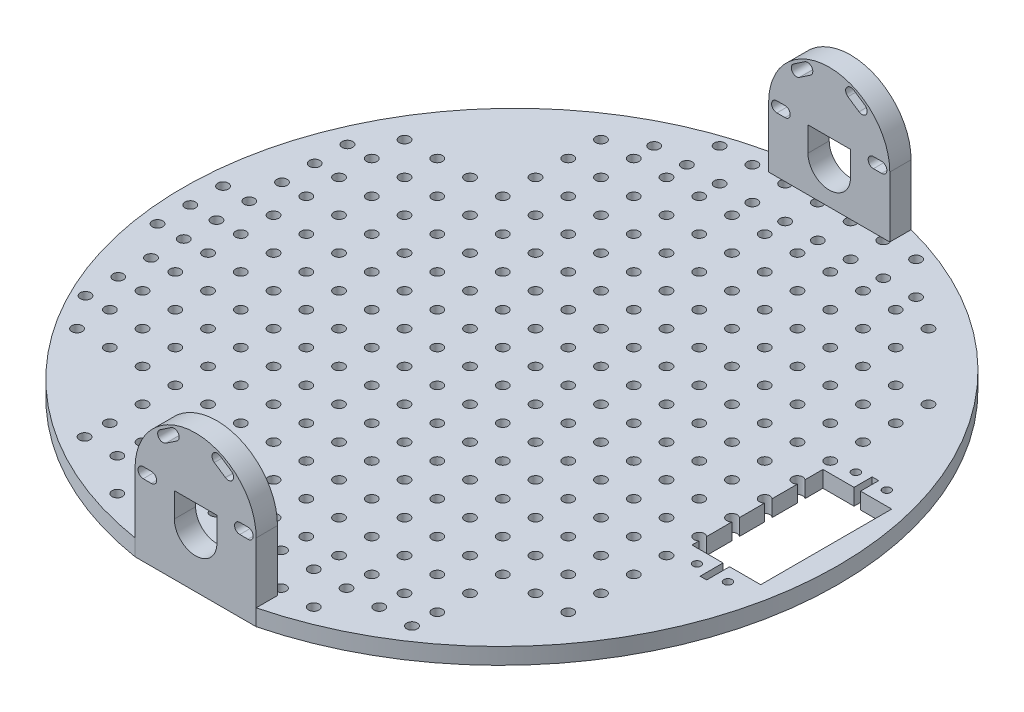
from build123d import *

# Parameters (mm, degrees)
IZIM1_R                          = 18.5
Y_KSEKLIK_EKSTR_ZYON1_DEPTH      = 6.5
KES_EKSTR_ZYON1_DEPTH            = 6.5
Y_KSEKLIK_EKSTR_ZYON2_DEPTH      = 6.5
Y_KSEKLIK_EKSTR_ZYON3_DEPTH      = 30
Y_KSEKLIK_EKSTR_ZYON3_DEPTH_BACK = 6.5
IZIM4_W                          = 37
IZIM4_H                          = 4
IZIM5_W                          = 36.995441418
IZIM5_H                          = 200
Y_KSEKLIK_EKSTR_ZYON4_DEPTH      = 4
Y_KSEKLIK_EKSTR_ZYON6_DEPTH      = 6.5
Y_KSEKLIK_EKSTR_ZYON7_DEPTH      = 4
Y_KSEKLIK_EKSTR_ZYON8_DEPTH      = 6
Y_KSEKLIK_EKSTR_ZYON11_DEPTH     = 10
IZIM17_R                         = 1.6
KES_EKSTR_ZYON2_DEPTH            = 95
IZIM18_R                         = 1.243463058
IZIM18_R_2                       = 1.205968855
IZIM18_R_3                       = 1.223996279
IZIM18_R_4                       = 1.236716662
KES_EKSTR_ZYON3_DEPTH            = 95
IZIM20_R                         = 1.6
KES_EKSTR_ZYON4_DEPTH            = 10
KES_EKSTR_ZYON5_START            = -5
KES_EKSTR_ZYON5_DEPTH            = 5


with BuildPart() as part:
    # Çizim1 → Yükseklik-Ekstrüzyon1 (new body)
    with BuildSketch(Plane.XY):
        with Locations(Location((0, 0, 0), (0, 0, 180))):
            Circle(IZIM1_R)
    extrude(amount=Y_KSEKLIK_EKSTR_ZYON1_DEPTH)

    # Çizim2 → Kes-Ekstrüzyon1 (cut)
    with BuildSketch(Plane.XY.offset(6.5)):
        with BuildLine():
            Line((6.5, 0), (6.5, -7.5))
            ThreePointArc((6.5, -7.5), (0, -14), (-6.5, -7.5))
            Line((-6.5, -7.5), (-6.5, 0))
            Line((-6.5, 0), (6.5, 0))
        make_face()
        with BuildLine():
            Line((-16, 1.6), (-13.5, 1.6))
            ThreePointArc((-13.5, 1.6), (-11.9, 0), (-13.5, -1.6))
            Line((-13.5, -1.6), (-16, -1.6))
            ThreePointArc((-16, -1.6), (-17.6, 0), (-16, 1.6))
        make_face()
        with BuildLine():
            Line((16, -1.6), (13.5, -1.6))
            ThreePointArc((13.5, -1.6), (11.9, 0), (13.5, 1.6))
            Line((13.5, 1.6), (16, 1.6))
            ThreePointArc((16, 1.6), (17.6, 0), (16, -1.6))
        make_face()
        with BuildLine():
            Line((7.510154292, 16.186602557), (10.890511962, 13.897826987))
            ThreePointArc((10.890511962, 13.897826987), (11.31834042, 11.675899263), (9.096412696, 11.248070806))
            Line((9.096412696, 11.248070806), (5.716055026, 13.536846375))
            ThreePointArc((5.716055026, 13.536846375), (5.288226568, 15.758774099), (7.510154292, 16.186602557))
        make_face()
        with BuildLine():
            Line((-7.510154292, 16.186602557), (-10.890511962, 13.897826987))
            ThreePointArc((-10.890511962, 13.897826987), (-11.31834042, 11.675899263), (-9.096412696, 11.248070806))
            Line((-9.096412696, 11.248070806), (-5.716055026, 13.536846375))
            ThreePointArc((-5.716055026, 13.536846375), (-5.288226568, 15.758774099), (-7.510154292, 16.186602557))
        make_face()
    extrude(amount=-KES_EKSTR_ZYON1_DEPTH, mode=Mode.SUBTRACT)

    # Çizim3 → Yükseklik-Ekstrüzyon2 (add)
    with BuildSketch(Plane(origin=(0, 0, 0), x_dir=(-1, 0, 0), z_dir=(0, 0, -1))):
        with BuildLine():
            ThreePointArc((0, -18.5), (-13.081475452, -13.081475452), (-18.5, 0))
            Line((-18.5, 0), (-18.5, -18.5))
            Line((-18.5, -18.5), (0, -18.5))
        make_face()
        with BuildLine():
            Line((18.5, -18.5), (18.5, 0))
            ThreePointArc((18.5, 0), (13.081475452, -13.081475452), (0, -18.5))
            Line((0, -18.5), (18.5, -18.5))
        make_face()
    extrude(amount=-Y_KSEKLIK_EKSTR_ZYON2_DEPTH)

    # Çizim4 → Yükseklik-Ekstrüzyon3 (add, two sides: drawn at the far end of the back side and taken through both)
    with BuildSketch(Plane.XY.offset(6.5).offset(-Y_KSEKLIK_EKSTR_ZYON3_DEPTH_BACK)):
        with Locations((0, -20.5)):
            Rectangle(IZIM4_W, IZIM4_H)
    extrude(amount=Y_KSEKLIK_EKSTR_ZYON3_DEPTH + Y_KSEKLIK_EKSTR_ZYON3_DEPTH_BACK)

    # Çizim5 → Yükseklik-Ekstrüzyon4 (add)
    with BuildSketch(Plane.XZ.offset(22.5)):
        with Locations((-0.002279291, 100)):
            Rectangle(IZIM5_W, IZIM5_H)
    extrude(amount=-Y_KSEKLIK_EKSTR_ZYON4_DEPTH)

    # Çizim10 → Yükseklik-Ekstrüzyon6 (add)
    with BuildSketch(Plane.XY.offset(200)):
        with BuildLine():
            Line((-18.5, 0), (-18.5, -18.5))
            Line((-18.5, -18.5), (18.5, -18.5))
            Line((18.5, -18.5), (18.5, 0))
            ThreePointArc((18.5, 0), (0, 18.5), (-18.5, 0))
        make_face()
        with BuildLine():
            Line((5.716055026, 13.536846375), (9.096412696, 11.248070806))
            ThreePointArc((9.096412696, 11.248070806), (11.31834042, 11.675899263), (10.890511962, 13.897826987))
            Line((10.890511962, 13.897826987), (7.510154292, 16.186602557))
            ThreePointArc((7.510154292, 16.186602557), (5.288226568, 15.758774099), (5.716055026, 13.536846375))
        make_face(mode=Mode.SUBTRACT)
        with BuildLine():
            Line((-7.510154292, 16.186602557), (-10.890511962, 13.897826987))
            ThreePointArc((-10.890511962, 13.897826987), (-11.31834042, 11.675899263), (-9.096412696, 11.248070806))
            Line((-9.096412696, 11.248070806), (-5.716055026, 13.536846375))
            ThreePointArc((-5.716055026, 13.536846375), (-5.288226568, 15.758774099), (-7.510154292, 16.186602557))
        make_face(mode=Mode.SUBTRACT)
        with BuildLine():
            Line((-13.5, 1.6), (-16, 1.6))
            ThreePointArc((-16, 1.6), (-17.6, 0), (-16, -1.6))
            Line((-16, -1.6), (-13.5, -1.6))
            ThreePointArc((-13.5, -1.6), (-11.9, 0), (-13.5, 1.6))
        make_face(mode=Mode.SUBTRACT)
        with BuildLine():
            Line((6.5, -7.5), (6.5, 0))
            Line((6.5, 0), (-6.5, 0))
            Line((-6.5, 0), (-6.5, -7.5))
            ThreePointArc((-6.5, -7.5), (0, -14), (6.5, -7.5))
        make_face(mode=Mode.SUBTRACT)
        with BuildLine():
            Line((13.5, -1.6), (16, -1.6))
            ThreePointArc((16, -1.6), (17.6, 0), (16, 1.6))
            Line((16, 1.6), (13.5, 1.6))
            ThreePointArc((13.5, 1.6), (11.9, 0), (13.5, -1.6))
        make_face(mode=Mode.SUBTRACT)
    extrude(amount=-Y_KSEKLIK_EKSTR_ZYON6_DEPTH)

    # Çizim12 → Yükseklik-Ekstrüzyon7 (add)
    with BuildSketch(Plane(origin=(0, -18.5, 0), x_dir=(1, 0, 0), z_dir=(0, 1, 0))):
        with BuildLine():
            Line((-18.5, 0), (-18.5, -200))
            ThreePointArc((-18.5, -200), (-103.80746971, -100), (-18.5, 0))
        make_face()
    extrude(amount=-Y_KSEKLIK_EKSTR_ZYON7_DEPTH)

    # Çizim14 → Yükseklik-Ekstrüzyon8 (add)
    with BuildSketch(Plane.XZ.offset(22.5)):
        with BuildLine():
            Line((18.5, 36.5), (18.495441418, 36.5))
            Line((18.495441418, 36.5), (18.495441418, 200))
            Line((18.495441418, 200), (-18.5, 200))
            ThreePointArc((-18.5, 200), (-103.80746971, 100), (-18.5, 0))
            Line((-18.5, 0), (18.5, 0))
            Line((18.5, 0), (18.5, 36.5))
        make_face()
    extrude(amount=Y_KSEKLIK_EKSTR_ZYON8_DEPTH)

    # Çizim16 → Yükseklik-Ekstrüzyon11 (add)
    with BuildSketch(Plane(origin=(0, -18.5, 0), x_dir=(1, 0, 0), z_dir=(0, 1, 0))):
        with BuildLine():
            ThreePointArc((18.5, 0), (96.19253029, -100), (18.5, -200))
            Line((18.5, -200), (-18.5, -200))
            Line((-18.5, -200), (-18.5, -193.5))
            Line((-18.5, -193.5), (18.495441418, -193.5))
            Line((18.495441418, -193.5), (18.495441418, -36.5))
            Line((18.495441418, -36.5), (18.5, -36.5))
            Line((18.5, -36.5), (18.5, -6.5))
            Line((18.5, -6.5), (-18.5, -6.5))
            Line((-18.5, -6.5), (-18.5, 0))
            Line((-18.5, 0), (18.5, 0))
        make_face()
        with BuildLine():
            Line((18.5, -36.5), (18.5, -6.5))
            Line((18.5, -6.5), (-18.5, -6.5))
            Line((-18.5, -6.5), (-18.5, 0))
            ThreePointArc((-18.5, 0), (-103.80746971, -100), (-18.5, -200))
            Line((-18.5, -200), (-18.5, -193.5))
            Line((-18.5, -193.5), (18.495441418, -193.5))
            Line((18.495441418, -193.5), (18.495441418, -36.5))
            Line((18.495441418, -36.5), (18.5, -36.5))
        make_face()
    extrude(amount=-Y_KSEKLIK_EKSTR_ZYON11_DEPTH)

    # Çizim17 → Kes-Ekstrüzyon2 (cut)
    with BuildSketch(Plane(origin=(0, -18.5, 0), x_dir=(1, 0, 0), z_dir=(0, 1, 0))):
        with Locations(Location((-52.685579555, -23.513505343, 0), (0, 0, 270))):
            Circle(IZIM17_R)
        with Locations(Location((-42.685579555, -23.513505343, 0), (0, 0, 270))):
            Circle(IZIM17_R)
        with Locations(Location((-32.685579555, -23.513505343, 0), (0, 0, 270))):
            Circle(IZIM17_R)
        with Locations(Location((-22.685579555, -23.513505343, 0), (0, 0, 270))):
            Circle(IZIM17_R)
        with Locations(Location((-12.685579555, -23.513505343, 0), (0, 0, 270))):
            Circle(IZIM17_R)
        with Locations(Location((-2.685579555, -23.513505343, 0), (0, 0, 270))):
            Circle(IZIM17_R)
        with Locations(Location((7.314420445, -23.513505343, 0), (0, 0, 270))):
            Circle(IZIM17_R)
        with Locations(Location((17.314420445, -23.513505343, 0), (0, 0, 270))):
            Circle(IZIM17_R)
        with Locations(Location((27.314420445, -23.513505343, 0), (0, 0, 270))):
            Circle(IZIM17_R)
        with Locations(Location((37.314420445, -23.513505343, 0), (0, 0, 270))):
            Circle(IZIM17_R)
        with Locations(Location((47.314420445, -23.513505343, 0), (0, 0, 270))):
            Circle(IZIM17_R)
        with Locations(Location((-42.685579555, -33.513505343, 0), (0, 0, 270))):
            Circle(IZIM17_R)
        with Locations(Location((-32.685579555, -33.513505343, 0), (0, 0, 270))):
            Circle(IZIM17_R)
        with Locations(Location((-22.685579555, -33.513505343, 0), (0, 0, 270))):
            Circle(IZIM17_R)
        with Locations(Location((-12.685579555, -33.513505343, 0), (0, 0, 270))):
            Circle(IZIM17_R)
        with Locations(Location((-2.685579555, -33.513505343, 0), (0, 0, 270))):
            Circle(IZIM17_R)
        with Locations(Location((7.314420445, -33.513505343, 0), (0, 0, 270))):
            Circle(IZIM17_R)
        with Locations(Location((17.314420445, -33.513505343, 0), (0, 0, 270))):
            Circle(IZIM17_R)
        with Locations(Location((27.314420445, -33.513505343, 0), (0, 0, 270))):
            Circle(IZIM17_R)
        with Locations(Location((37.314420445, -33.513505343, 0), (0, 0, 270))):
            Circle(IZIM17_R)
        with Locations(Location((47.314420445, -33.513505343, 0), (0, 0, 270))):
            Circle(IZIM17_R)
        with Locations(Location((-42.685579555, -43.513505343, 0), (0, 0, 270))):
            Circle(IZIM17_R)
        with Locations(Location((-32.685579555, -43.513505343, 0), (0, 0, 270))):
            Circle(IZIM17_R)
        with Locations(Location((-22.685579555, -43.513505343, 0), (0, 0, 270))):
            Circle(IZIM17_R)
        with Locations(Location((-12.685579555, -43.513505343, 0), (0, 0, 270))):
            Circle(IZIM17_R)
        with Locations(Location((-2.685579555, -43.513505343, 0), (0, 0, 270))):
            Circle(IZIM17_R)
        with Locations(Location((7.314420445, -43.513505343, 0), (0, 0, 270))):
            Circle(IZIM17_R)
        with Locations(Location((17.314420445, -43.513505343, 0), (0, 0, 270))):
            Circle(IZIM17_R)
        with Locations(Location((27.314420445, -43.513505343, 0), (0, 0, 270))):
            Circle(IZIM17_R)
        with Locations(Location((37.314420445, -43.513505343, 0), (0, 0, 270))):
            Circle(IZIM17_R)
        with Locations(Location((47.314420445, -43.513505343, 0), (0, 0, 270))):
            Circle(IZIM17_R)
        with Locations(Location((-42.685579555, -53.513505343, 0), (0, 0, 270))):
            Circle(IZIM17_R)
        with Locations(Location((-32.685579555, -53.513505343, 0), (0, 0, 270))):
            Circle(IZIM17_R)
        with Locations(Location((-22.685579555, -53.513505343, 0), (0, 0, 270))):
            Circle(IZIM17_R)
        with Locations(Location((-12.685579555, -53.513505343, 0), (0, 0, 270))):
            Circle(IZIM17_R)
        with Locations(Location((-2.685579555, -53.513505343, 0), (0, 0, 270))):
            Circle(IZIM17_R)
        with Locations(Location((7.314420445, -53.513505343, 0), (0, 0, 270))):
            Circle(IZIM17_R)
        with Locations(Location((17.314420445, -53.513505343, 0), (0, 0, 270))):
            Circle(IZIM17_R)
        with Locations(Location((27.314420445, -53.513505343, 0), (0, 0, 270))):
            Circle(IZIM17_R)
        with Locations(Location((37.314420445, -53.513505343, 0), (0, 0, 270))):
            Circle(IZIM17_R)
        with Locations(Location((47.314420445, -53.513505343, 0), (0, 0, 270))):
            Circle(IZIM17_R)
        with Locations(Location((-42.685579555, -63.513505343, 0), (0, 0, 270))):
            Circle(IZIM17_R)
        with Locations(Location((-32.685579555, -63.513505343, 0), (0, 0, 270))):
            Circle(IZIM17_R)
        with Locations(Location((-22.685579555, -63.513505343, 0), (0, 0, 270))):
            Circle(IZIM17_R)
        with Locations(Location((-12.685579555, -63.513505343, 0), (0, 0, 270))):
            Circle(IZIM17_R)
        with Locations(Location((-2.685579555, -63.513505343, 0), (0, 0, 270))):
            Circle(IZIM17_R)
        with Locations(Location((7.314420445, -63.513505343, 0), (0, 0, 270))):
            Circle(IZIM17_R)
        with Locations(Location((17.314420445, -63.513505343, 0), (0, 0, 270))):
            Circle(IZIM17_R)
        with Locations(Location((27.314420445, -63.513505343, 0), (0, 0, 270))):
            Circle(IZIM17_R)
        with Locations(Location((37.314420445, -63.513505343, 0), (0, 0, 270))):
            Circle(IZIM17_R)
        with Locations(Location((47.314420445, -63.513505343, 0), (0, 0, 270))):
            Circle(IZIM17_R)
        with Locations(Location((-42.685579555, -73.513505343, 0), (0, 0, 270))):
            Circle(IZIM17_R)
        with Locations(Location((-32.685579555, -73.513505343, 0), (0, 0, 270))):
            Circle(IZIM17_R)
        with Locations(Location((-22.685579555, -73.513505343, 0), (0, 0, 270))):
            Circle(IZIM17_R)
        with Locations(Location((-12.685579555, -73.513505343, 0), (0, 0, 270))):
            Circle(IZIM17_R)
        with Locations(Location((-2.685579555, -73.513505343, 0), (0, 0, 270))):
            Circle(IZIM17_R)
        with Locations(Location((7.314420445, -73.513505343, 0), (0, 0, 270))):
            Circle(IZIM17_R)
        with Locations(Location((17.314420445, -73.513505343, 0), (0, 0, 270))):
            Circle(IZIM17_R)
        with Locations(Location((27.314420445, -73.513505343, 0), (0, 0, 270))):
            Circle(IZIM17_R)
        with Locations(Location((37.314420445, -73.513505343, 0), (0, 0, 270))):
            Circle(IZIM17_R)
        with Locations(Location((47.314420445, -73.513505343, 0), (0, 0, 270))):
            Circle(IZIM17_R)
        with Locations(Location((-42.685579555, -83.513505343, 0), (0, 0, 270))):
            Circle(IZIM17_R)
        with Locations(Location((-32.685579555, -83.513505343, 0), (0, 0, 270))):
            Circle(IZIM17_R)
        with Locations(Location((-22.685579555, -83.513505343, 0), (0, 0, 270))):
            Circle(IZIM17_R)
        with Locations(Location((-12.685579555, -83.513505343, 0), (0, 0, 270))):
            Circle(IZIM17_R)
        with Locations(Location((-2.685579555, -83.513505343, 0), (0, 0, 270))):
            Circle(IZIM17_R)
        with Locations(Location((7.314420445, -83.513505343, 0), (0, 0, 270))):
            Circle(IZIM17_R)
        with Locations(Location((17.314420445, -83.513505343, 0), (0, 0, 270))):
            Circle(IZIM17_R)
        with Locations(Location((27.314420445, -83.513505343, 0), (0, 0, 270))):
            Circle(IZIM17_R)
        with Locations(Location((37.314420445, -83.513505343, 0), (0, 0, 270))):
            Circle(IZIM17_R)
        with Locations(Location((47.314420445, -83.513505343, 0), (0, 0, 270))):
            Circle(IZIM17_R)
        with Locations(Location((-42.685579555, -93.513505343, 0), (0, 0, 270))):
            Circle(IZIM17_R)
        with Locations(Location((-32.685579555, -93.513505343, 0), (0, 0, 270))):
            Circle(IZIM17_R)
        with Locations(Location((-22.685579555, -93.513505343, 0), (0, 0, 270))):
            Circle(IZIM17_R)
        with Locations(Location((-12.685579555, -93.513505343, 0), (0, 0, 270))):
            Circle(IZIM17_R)
        with Locations(Location((-2.685579555, -93.513505343, 0), (0, 0, 270))):
            Circle(IZIM17_R)
        with Locations(Location((7.314420445, -93.513505343, 0), (0, 0, 270))):
            Circle(IZIM17_R)
        with Locations(Location((17.314420445, -93.513505343, 0), (0, 0, 270))):
            Circle(IZIM17_R)
        with Locations(Location((27.314420445, -93.513505343, 0), (0, 0, 270))):
            Circle(IZIM17_R)
        with Locations(Location((37.314420445, -93.513505343, 0), (0, 0, 270))):
            Circle(IZIM17_R)
        with Locations(Location((47.314420445, -93.513505343, 0), (0, 0, 270))):
            Circle(IZIM17_R)
        with Locations(Location((-42.685579555, -103.513505343, 0), (0, 0, 270))):
            Circle(IZIM17_R)
        with Locations(Location((-32.685579555, -103.513505343, 0), (0, 0, 270))):
            Circle(IZIM17_R)
        with Locations(Location((-22.685579555, -103.513505343, 0), (0, 0, 270))):
            Circle(IZIM17_R)
        with Locations(Location((-12.685579555, -103.513505343, 0), (0, 0, 270))):
            Circle(IZIM17_R)
        with Locations(Location((-2.685579555, -103.513505343, 0), (0, 0, 270))):
            Circle(IZIM17_R)
        with Locations(Location((7.314420445, -103.513505343, 0), (0, 0, 270))):
            Circle(IZIM17_R)
        with Locations(Location((17.314420445, -103.513505343, 0), (0, 0, 270))):
            Circle(IZIM17_R)
        with Locations(Location((27.314420445, -103.513505343, 0), (0, 0, 270))):
            Circle(IZIM17_R)
        with Locations(Location((37.314420445, -103.513505343, 0), (0, 0, 270))):
            Circle(IZIM17_R)
        with Locations(Location((47.314420445, -103.513505343, 0), (0, 0, 270))):
            Circle(IZIM17_R)
        with Locations(Location((-42.685579555, -113.513505343, 0), (0, 0, 270))):
            Circle(IZIM17_R)
        with Locations(Location((-32.685579555, -113.513505343, 0), (0, 0, 270))):
            Circle(IZIM17_R)
        with Locations(Location((-22.685579555, -113.513505343, 0), (0, 0, 270))):
            Circle(IZIM17_R)
        with Locations(Location((-12.685579555, -113.513505343, 0), (0, 0, 270))):
            Circle(IZIM17_R)
        with Locations(Location((-2.685579555, -113.513505343, 0), (0, 0, 270))):
            Circle(IZIM17_R)
        with Locations(Location((7.314420445, -113.513505343, 0), (0, 0, 270))):
            Circle(IZIM17_R)
        with Locations(Location((17.314420445, -113.513505343, 0), (0, 0, 270))):
            Circle(IZIM17_R)
        with Locations(Location((27.314420445, -113.513505343, 0), (0, 0, 270))):
            Circle(IZIM17_R)
        with Locations(Location((37.314420445, -113.513505343, 0), (0, 0, 270))):
            Circle(IZIM17_R)
        with Locations(Location((47.314420445, -113.513505343, 0), (0, 0, 270))):
            Circle(IZIM17_R)
        with Locations(Location((-42.685579555, -123.513505343, 0), (0, 0, 270))):
            Circle(IZIM17_R)
        with Locations(Location((-32.685579555, -123.513505343, 0), (0, 0, 270))):
            Circle(IZIM17_R)
        with Locations(Location((-22.685579555, -123.513505343, 0), (0, 0, 270))):
            Circle(IZIM17_R)
        with Locations(Location((-12.685579555, -123.513505343, 0), (0, 0, 270))):
            Circle(IZIM17_R)
        with Locations(Location((-2.685579555, -123.513505343, 0), (0, 0, 270))):
            Circle(IZIM17_R)
        with Locations(Location((7.314420445, -123.513505343, 0), (0, 0, 270))):
            Circle(IZIM17_R)
        with Locations(Location((17.314420445, -123.513505343, 0), (0, 0, 270))):
            Circle(IZIM17_R)
        with Locations(Location((27.314420445, -123.513505343, 0), (0, 0, 270))):
            Circle(IZIM17_R)
        with Locations(Location((37.314420445, -123.513505343, 0), (0, 0, 270))):
            Circle(IZIM17_R)
        with Locations(Location((47.314420445, -123.513505343, 0), (0, 0, 270))):
            Circle(IZIM17_R)
        with Locations(Location((-42.685579555, -133.513505343, 0), (0, 0, 270))):
            Circle(IZIM17_R)
        with Locations(Location((-32.685579555, -133.513505343, 0), (0, 0, 270))):
            Circle(IZIM17_R)
        with Locations(Location((-22.685579555, -133.513505343, 0), (0, 0, 270))):
            Circle(IZIM17_R)
        with Locations(Location((-12.685579555, -133.513505343, 0), (0, 0, 270))):
            Circle(IZIM17_R)
        with Locations(Location((-2.685579555, -133.513505343, 0), (0, 0, 270))):
            Circle(IZIM17_R)
        with Locations(Location((7.314420445, -133.513505343, 0), (0, 0, 270))):
            Circle(IZIM17_R)
        with Locations(Location((17.314420445, -133.513505343, 0), (0, 0, 270))):
            Circle(IZIM17_R)
        with Locations(Location((27.314420445, -133.513505343, 0), (0, 0, 270))):
            Circle(IZIM17_R)
        with Locations(Location((37.314420445, -133.513505343, 0), (0, 0, 270))):
            Circle(IZIM17_R)
        with Locations(Location((47.314420445, -133.513505343, 0), (0, 0, 270))):
            Circle(IZIM17_R)
        with Locations(Location((-42.685579555, -143.513505343, 0), (0, 0, 270))):
            Circle(IZIM17_R)
        with Locations(Location((-32.685579555, -143.513505343, 0), (0, 0, 270))):
            Circle(IZIM17_R)
        with Locations(Location((-22.685579555, -143.513505343, 0), (0, 0, 270))):
            Circle(IZIM17_R)
        with Locations(Location((-12.685579555, -143.513505343, 0), (0, 0, 270))):
            Circle(IZIM17_R)
        with Locations(Location((-2.685579555, -143.513505343, 0), (0, 0, 270))):
            Circle(IZIM17_R)
        with Locations(Location((7.314420445, -143.513505343, 0), (0, 0, 270))):
            Circle(IZIM17_R)
        with Locations(Location((17.314420445, -143.513505343, 0), (0, 0, 270))):
            Circle(IZIM17_R)
        with Locations(Location((27.314420445, -143.513505343, 0), (0, 0, 270))):
            Circle(IZIM17_R)
        with Locations(Location((37.314420445, -143.513505343, 0), (0, 0, 270))):
            Circle(IZIM17_R)
        with Locations(Location((47.314420445, -143.513505343, 0), (0, 0, 270))):
            Circle(IZIM17_R)
        with Locations(Location((-42.685579555, -153.513505343, 0), (0, 0, 270))):
            Circle(IZIM17_R)
        with Locations(Location((-32.685579555, -153.513505343, 0), (0, 0, 270))):
            Circle(IZIM17_R)
        with Locations(Location((-22.685579555, -153.513505343, 0), (0, 0, 270))):
            Circle(IZIM17_R)
        with Locations(Location((-12.685579555, -153.513505343, 0), (0, 0, 270))):
            Circle(IZIM17_R)
        with Locations(Location((-2.685579555, -153.513505343, 0), (0, 0, 270))):
            Circle(IZIM17_R)
        with Locations(Location((7.314420445, -153.513505343, 0), (0, 0, 270))):
            Circle(IZIM17_R)
        with Locations(Location((17.314420445, -153.513505343, 0), (0, 0, 270))):
            Circle(IZIM17_R)
        with Locations(Location((27.314420445, -153.513505343, 0), (0, 0, 270))):
            Circle(IZIM17_R)
        with Locations(Location((37.314420445, -153.513505343, 0), (0, 0, 270))):
            Circle(IZIM17_R)
        with Locations(Location((47.314420445, -153.513505343, 0), (0, 0, 270))):
            Circle(IZIM17_R)
        with Locations(Location((-42.685579555, -163.513505343, 0), (0, 0, 270))):
            Circle(IZIM17_R)
        with Locations(Location((-32.685579555, -163.513505343, 0), (0, 0, 270))):
            Circle(IZIM17_R)
        with Locations(Location((-22.685579555, -163.513505343, 0), (0, 0, 270))):
            Circle(IZIM17_R)
        with Locations(Location((-12.685579555, -163.513505343, 0), (0, 0, 270))):
            Circle(IZIM17_R)
        with Locations(Location((-2.685579555, -163.513505343, 0), (0, 0, 270))):
            Circle(IZIM17_R)
        with Locations(Location((7.314420445, -163.513505343, 0), (0, 0, 270))):
            Circle(IZIM17_R)
        with Locations(Location((17.314420445, -163.513505343, 0), (0, 0, 270))):
            Circle(IZIM17_R)
        with Locations(Location((27.314420445, -163.513505343, 0), (0, 0, 270))):
            Circle(IZIM17_R)
        with Locations(Location((37.314420445, -163.513505343, 0), (0, 0, 270))):
            Circle(IZIM17_R)
        with Locations(Location((47.314420445, -163.513505343, 0), (0, 0, 270))):
            Circle(IZIM17_R)
        with Locations(Location((-42.685579555, -173.513505343, 0), (0, 0, 270))):
            Circle(IZIM17_R)
        with Locations(Location((-32.685579555, -173.513505343, 0), (0, 0, 270))):
            Circle(IZIM17_R)
        with Locations(Location((-22.685579555, -173.513505343, 0), (0, 0, 270))):
            Circle(IZIM17_R)
        with Locations(Location((-12.685579555, -173.513505343, 0), (0, 0, 270))):
            Circle(IZIM17_R)
        with Locations(Location((-2.685579555, -173.513505343, 0), (0, 0, 270))):
            Circle(IZIM17_R)
        with Locations(Location((7.314420445, -173.513505343, 0), (0, 0, 270))):
            Circle(IZIM17_R)
        with Locations(Location((17.314420445, -173.513505343, 0), (0, 0, 270))):
            Circle(IZIM17_R)
        with Locations(Location((27.314420445, -173.513505343, 0), (0, 0, 270))):
            Circle(IZIM17_R)
        with Locations(Location((37.314420445, -173.513505343, 0), (0, 0, 270))):
            Circle(IZIM17_R)
        with Locations(Location((47.314420445, -173.513505343, 0), (0, 0, 270))):
            Circle(IZIM17_R)
        with Locations(Location((-52.685579555, -33.513505343, 0), (0, 0, 270))):
            Circle(IZIM17_R)
        with Locations(Location((-52.685579555, -43.513505343, 0), (0, 0, 270))):
            Circle(IZIM17_R)
        with Locations(Location((-52.685579555, -53.513505343, 0), (0, 0, 270))):
            Circle(IZIM17_R)
        with Locations(Location((-52.685579555, -63.513505343, 0), (0, 0, 270))):
            Circle(IZIM17_R)
        with Locations(Location((-52.685579555, -73.513505343, 0), (0, 0, 270))):
            Circle(IZIM17_R)
        with Locations(Location((-52.685579555, -83.513505343, 0), (0, 0, 270))):
            Circle(IZIM17_R)
        with Locations(Location((-52.685579555, -93.513505343, 0), (0, 0, 270))):
            Circle(IZIM17_R)
        with Locations(Location((-52.685579555, -103.513505343, 0), (0, 0, 270))):
            Circle(IZIM17_R)
        with Locations(Location((-52.685579555, -113.513505343, 0), (0, 0, 270))):
            Circle(IZIM17_R)
        with Locations(Location((-52.685579555, -123.513505343, 0), (0, 0, 270))):
            Circle(IZIM17_R)
        with Locations(Location((-52.685579555, -133.513505343, 0), (0, 0, 270))):
            Circle(IZIM17_R)
        with Locations(Location((-52.685579555, -143.513505343, 0), (0, 0, 270))):
            Circle(IZIM17_R)
        with Locations(Location((-52.685579555, -153.513505343, 0), (0, 0, 270))):
            Circle(IZIM17_R)
        with Locations(Location((-52.685579555, -163.513505343, 0), (0, 0, 270))):
            Circle(IZIM17_R)
        with Locations(Location((-52.685579555, -173.513505343, 0), (0, 0, 270))):
            Circle(IZIM17_R)
        with Locations(Location((-62.685579555, -93.513505343, 0), (0, 0, 270))):
            Circle(IZIM17_R)
        with Locations(Location((-72.685579555, -93.513505343, 0), (0, 0, 270))):
            Circle(IZIM17_R)
        with Locations(Location((-82.685579555, -93.513505343, 0), (0, 0, 270))):
            Circle(IZIM17_R)
        with Locations(Location((-62.685579555, -83.513505343, 0), (0, 0, 270))):
            Circle(IZIM17_R)
        with Locations(Location((-72.685579555, -83.513505343, 0), (0, 0, 270))):
            Circle(IZIM17_R)
        with Locations(Location((-82.685579555, -83.513505343, 0), (0, 0, 270))):
            Circle(IZIM17_R)
        with Locations(Location((-62.685579555, -73.513505343, 0), (0, 0, 270))):
            Circle(IZIM17_R)
        with Locations(Location((-72.685579555, -73.513505343, 0), (0, 0, 270))):
            Circle(IZIM17_R)
        with Locations(Location((-82.685579555, -73.513505343, 0), (0, 0, 270))):
            Circle(IZIM17_R)
        with Locations(Location((-62.685579555, -63.513505343, 0), (0, 0, 270))):
            Circle(IZIM17_R)
        with Locations(Location((-72.685579555, -63.513505343, 0), (0, 0, 270))):
            Circle(IZIM17_R)
        with Locations(Location((-82.685579555, -63.513505343, 0), (0, 0, 270))):
            Circle(IZIM17_R)
        with Locations(Location((-62.685579555, -53.513505343, 0), (0, 0, 270))):
            Circle(IZIM17_R)
        with Locations(Location((-72.685579555, -53.513505343, 0), (0, 0, 270))):
            Circle(IZIM17_R)
        with Locations(Location((-82.685579555, -53.513505343, 0), (0, 0, 270))):
            Circle(IZIM17_R)
        with Locations(Location((-62.685579555, -103.513505343, 0), (0, 0, 270))):
            Circle(IZIM17_R)
        with Locations(Location((-72.685579555, -103.513505343, 0), (0, 0, 270))):
            Circle(IZIM17_R)
        with Locations(Location((-82.685579555, -103.513505343, 0), (0, 0, 270))):
            Circle(IZIM17_R)
        with Locations(Location((-62.685579555, -113.513505343, 0), (0, 0, 270))):
            Circle(IZIM17_R)
        with Locations(Location((-72.685579555, -113.513505343, 0), (0, 0, 270))):
            Circle(IZIM17_R)
        with Locations(Location((-82.685579555, -113.513505343, 0), (0, 0, 270))):
            Circle(IZIM17_R)
        with Locations(Location((-62.685579555, -123.513505343, 0), (0, 0, 270))):
            Circle(IZIM17_R)
        with Locations(Location((-72.685579555, -123.513505343, 0), (0, 0, 270))):
            Circle(IZIM17_R)
        with Locations(Location((-82.685579555, -123.513505343, 0), (0, 0, 270))):
            Circle(IZIM17_R)
        with Locations(Location((-62.685579555, -133.513505343, 0), (0, 0, 270))):
            Circle(IZIM17_R)
        with Locations(Location((-72.685579555, -133.513505343, 0), (0, 0, 270))):
            Circle(IZIM17_R)
        with Locations(Location((-82.685579555, -133.513505343, 0), (0, 0, 270))):
            Circle(IZIM17_R)
        with Locations(Location((-62.685579555, -143.513505343, 0), (0, 0, 270))):
            Circle(IZIM17_R)
        with Locations(Location((-72.685579555, -143.513505343, 0), (0, 0, 270))):
            Circle(IZIM17_R)
        with Locations(Location((-82.685579555, -143.513505343, 0), (0, 0, 270))):
            Circle(IZIM17_R)
        with Locations(Location((-62.685579555, -153.513505343, 0), (0, 0, 270))):
            Circle(IZIM17_R)
        with Locations(Location((-72.685579555, -153.513505343, 0), (0, 0, 270))):
            Circle(IZIM17_R)
        with Locations(Location((-82.685579555, -153.513505343, 0), (0, 0, 270))):
            Circle(IZIM17_R)
        with Locations(Location((57.314420445, -153.513505343, 0), (0, 0, 270))):
            Circle(IZIM17_R)
        with Locations(Location((67.314420445, -153.513505343, 0), (0, 0, 270))):
            Circle(IZIM17_R)
        with Locations(Location((57.314420445, -143.513505343, 0), (0, 0, 270))):
            Circle(IZIM17_R)
        with Locations(Location((67.314420445, -143.513505343, 0), (0, 0, 270))):
            Circle(IZIM17_R)
        with Locations(Location((57.314420445, -133.513505343, 0), (0, 0, 270))):
            Circle(IZIM17_R)
        with Locations(Location((67.314420445, -133.513505343, 0), (0, 0, 270))):
            Circle(IZIM17_R)
        with Locations(Location((57.314420445, -123.513505343, 0), (0, 0, 270))):
            Circle(IZIM17_R)
        with Locations(Location((67.314420445, -123.513505343, 0), (0, 0, 270))):
            Circle(IZIM17_R)
        with Locations(Location((57.314420445, -113.513505343, 0), (0, 0, 270))):
            Circle(IZIM17_R)
        with Locations(Location((67.314420445, -113.513505343, 0), (0, 0, 270))):
            Circle(IZIM17_R)
        with Locations(Location((57.314420445, -103.513505343, 0), (0, 0, 270))):
            Circle(IZIM17_R)
        with Locations(Location((67.314420445, -103.513505343, 0), (0, 0, 270))):
            Circle(IZIM17_R)
        with Locations(Location((57.314420445, -93.513505343, 0), (0, 0, 270))):
            Circle(IZIM17_R)
        with Locations(Location((67.314420445, -93.513505343, 0), (0, 0, 270))):
            Circle(IZIM17_R)
        with Locations(Location((57.314420445, -83.513505343, 0), (0, 0, 270))):
            Circle(IZIM17_R)
        with Locations(Location((67.314420445, -83.513505343, 0), (0, 0, 270))):
            Circle(IZIM17_R)
        with Locations(Location((57.314420445, -73.513505343, 0), (0, 0, 270))):
            Circle(IZIM17_R)
        with Locations(Location((67.314420445, -73.513505343, 0), (0, 0, 270))):
            Circle(IZIM17_R)
        with Locations(Location((57.314420445, -63.513505343, 0), (0, 0, 270))):
            Circle(IZIM17_R)
        with Locations(Location((67.314420445, -63.513505343, 0), (0, 0, 270))):
            Circle(IZIM17_R)
        with Locations(Location((57.314420445, -53.513505343, 0), (0, 0, 270))):
            Circle(IZIM17_R)
        with Locations(Location((67.314420445, -53.513505343, 0), (0, 0, 270))):
            Circle(IZIM17_R)
        with Locations(Location((57.314420445, -43.513505343, 0), (0, 0, 270))):
            Circle(IZIM17_R)
        with Locations(Location((67.314420445, -43.513505343, 0), (0, 0, 270))):
            Circle(IZIM17_R)
    extrude(amount=-KES_EKSTR_ZYON2_DEPTH, mode=Mode.SUBTRACT)

    # Çizim18 → Kes-Ekstrüzyon3 (cut)
    with BuildSketch(Plane(origin=(0, -18.5, 0), x_dir=(1, 0, 0), z_dir=(0, 1, 0))):
        with Locations(Location((83.664291814, -121.087249213, 0), (0, 0, 270))):
            Circle(IZIM18_R)
        with Locations(Location((74.172539459, -121.056760705, 0), (0, 0, 270))):
            Circle(IZIM18_R_2)
        with Locations(Location((83.663891709, -72.575848815, 0), (0, 0, 270))):
            Circle(IZIM18_R_3)
        with Locations(Location((74.197576972, -72.566891663, 0), (0, 0, 270))):
            Circle(IZIM18_R_4)
        Polygon((89.416584042, -76.840461811), (89.416584042, -116.840460917), (79.917584472, -116.840460917), (79.917584472, -123.840462064), (77.917584377, -123.840462064), (77.917584377, -116.840460917), (68.418584806, -116.840460917), (68.418584806, -76.840461811), (77.917584377, -76.840461811), (77.917584377, -71.306161832), (79.917584472, -71.306161832), (79.917584472, -76.840461811), align=None)
    extrude(amount=-KES_EKSTR_ZYON3_DEPTH, mode=Mode.SUBTRACT)

    # Çizim20 → Kes-Ekstrüzyon4 (cut)
    with BuildSketch(Plane.XZ.offset(28.5)):
        with Locations(Location((-52.911721767, 181.003496154, 0), (0, 0, 270))):
            Circle(IZIM20_R)
        with Locations(Location((-42.911721767, 181.003496154, 0), (0, 0, 270))):
            Circle(IZIM20_R)
        with Locations(Location((-32.911721767, 181.003496154, 0), (0, 0, 270))):
            Circle(IZIM20_R)
        with Locations(Location((-22.911721767, 181.003496154, 0), (0, 0, 270))):
            Circle(IZIM20_R)
        with Locations(Location((-12.911721767, 181.003496154, 0), (0, 0, 270))):
            Circle(IZIM20_R)
        with Locations(Location((-2.911721767, 181.003496154, 0), (0, 0, 270))):
            Circle(IZIM20_R)
        with Locations(Location((7.088278233, 181.003496154, 0), (0, 0, 270))):
            Circle(IZIM20_R)
        with Locations(Location((17.088278233, 181.003496154, 0), (0, 0, 270))):
            Circle(IZIM20_R)
        with Locations(Location((27.088278233, 181.003496154, 0), (0, 0, 270))):
            Circle(IZIM20_R)
        with Locations(Location((37.088278233, 181.003496154, 0), (0, 0, 270))):
            Circle(IZIM20_R)
        with Locations(Location((47.088278233, 181.003496154, 0), (0, 0, 270))):
            Circle(IZIM20_R)
        with Locations(Location((-42.911721767, 17.059033321, 0), (0, 0, 270))):
            Circle(IZIM20_R)
        with Locations(Location((-32.911721767, 191.003496154, 0), (0, 0, 270))):
            Circle(IZIM20_R)
        with Locations(Location((-22.911721767, 191.003496154, 0), (0, 0, 270))):
            Circle(IZIM20_R)
        with Locations(Location((-12.911721767, 191.003496154, 0), (0, 0, 270))):
            Circle(IZIM20_R)
        with Locations(Location((-2.911721767, 191.003496154, 0), (0, 0, 270))):
            Circle(IZIM20_R)
        with Locations(Location((7.088278233, 191.003496154, 0), (0, 0, 270))):
            Circle(IZIM20_R)
        with Locations(Location((17.088278233, 191.003496154, 0), (0, 0, 270))):
            Circle(IZIM20_R)
        with Locations(Location((27.088278233, 191.003496154, 0), (0, 0, 270))):
            Circle(IZIM20_R)
        with Locations(Location((-32.911721767, 17.059033321, 0), (0, 0, 270))):
            Circle(IZIM20_R)
        with Locations(Location((-22.911721767, 17.059033321, 0), (0, 0, 270))):
            Circle(IZIM20_R)
        with Locations(Location((-12.911721767, 17.059033321, 0), (0, 0, 270))):
            Circle(IZIM20_R)
        with Locations(Location((-2.911721767, 17.059033321, 0), (0, 0, 270))):
            Circle(IZIM20_R)
        with Locations(Location((7.088278233, 17.059033321, 0), (0, 0, 270))):
            Circle(IZIM20_R)
        with Locations(Location((17.088278233, 17.059033321, 0), (0, 0, 270))):
            Circle(IZIM20_R)
        with Locations(Location((27.088278233, 17.059033321, 0), (0, 0, 270))):
            Circle(IZIM20_R)
        with Locations(Location((37.088278233, 17.059033321, 0), (0, 0, 270))):
            Circle(IZIM20_R)
        with Locations(Location((-32.911721767, 7.059033321, 0), (0, 0, 270))):
            Circle(IZIM20_R)
        with Locations(Location((-22.911721767, 7.059033321, 0), (0, 0, 270))):
            Circle(IZIM20_R)
        with Locations(Location((-12.911721767, 7.059033321, 0), (0, 0, 270))):
            Circle(IZIM20_R)
        with Locations(Location((-2.911721767, 7.059033321, 0), (0, 0, 270))):
            Circle(IZIM20_R)
        with Locations(Location((7.088278233, 7.059033321, 0), (0, 0, 270))):
            Circle(IZIM20_R)
        with Locations(Location((17.088278233, 7.059033321, 0), (0, 0, 270))):
            Circle(IZIM20_R)
        with Locations(Location((27.088278233, 7.059033321, 0), (0, 0, 270))):
            Circle(IZIM20_R)
        with Locations(Location((-90.108050371, 143.513505343, 0), (0, 0, 270))):
            Circle(IZIM20_R)
        with Locations(Location((-98.108050371, 113.513505343, 0), (0, 0, 270))):
            Circle(IZIM20_R)
        with Locations(Location((-98.108050371, 103.513505343, 0), (0, 0, 270))):
            Circle(IZIM20_R)
        with Locations(Location((-98.108050371, 93.513505343, 0), (0, 0, 270))):
            Circle(IZIM20_R)
        with Locations(Location((-90.108050371, 133.513505343, 0), (0, 0, 270))):
            Circle(IZIM20_R)
        with Locations(Location((-90.108050371, 123.513505343, 0), (0, 0, 270))):
            Circle(IZIM20_R)
        with Locations(Location((-90.108050371, 113.513505343, 0), (0, 0, 270))):
            Circle(IZIM20_R)
        with Locations(Location((-90.108050371, 103.513505343, 0), (0, 0, 270))):
            Circle(IZIM20_R)
        with Locations(Location((-90.108050371, 93.513505343, 0), (0, 0, 270))):
            Circle(IZIM20_R)
        with Locations(Location((-90.108050371, 83.513505343, 0), (0, 0, 270))):
            Circle(IZIM20_R)
        with Locations(Location((-90.108050371, 73.513505343, 0), (0, 0, 270))):
            Circle(IZIM20_R)
        with Locations(Location((-90.108050371, 63.513505343, 0), (0, 0, 270))):
            Circle(IZIM20_R)
    extrude(amount=-KES_EKSTR_ZYON4_DEPTH, mode=Mode.SUBTRACT)

    # Çizim21 → Kes-Ekstrüzyon5 (cut)
    with BuildSketch(Plane.XZ.offset(28.5).offset(KES_EKSTR_ZYON5_START)):
        with BuildLine():
            Line((-18.5, 0), (18.5, 0))
            ThreePointArc((18.5, 0), (96.19253029, 100), (18.5, 200))
            Line((18.5, 200), (-18.5, 200))
            ThreePointArc((-18.5, 200), (-103.80746971, 100), (-18.5, 0))
        make_face()
    extrude(amount=KES_EKSTR_ZYON5_DEPTH, mode=Mode.SUBTRACT)


solid = part.part
